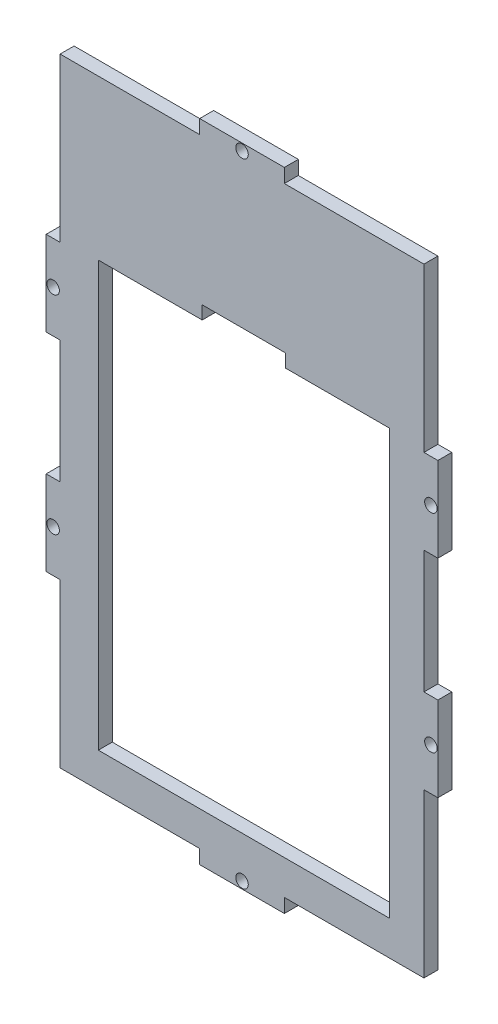
from build123d import *

# Parameters (mm, degrees)
BOSS_EXTRUDE1_DEPTH = 3.18
CUT_EXTRUDE1_DEPTH  = 82.82160381
SKETCH4_W           = 3.18
SKETCH4_H           = 19.3
BOSS_EXTRUDE2_DEPTH = 3.18
SKETCH5_R           = 1.425
CUT_EXTRUDE2_DEPTH  = 84.478168703
SKETCH6_W           = 3.18
SKETCH6_H           = 19.3
BOSS_EXTRUDE3_DEPTH = 3.18
SKETCH7_R           = 1.425
CUT_EXTRUDE3_DEPTH  = 84.478168703
SKETCH13_W          = 19.3
SKETCH13_H          = 3.18
BOSS_EXTRUDE6_DEPTH = 3.18
SKETCH14_R          = 1.425
CUT_EXTRUDE6_DEPTH  = 87.179315674
SKETCH15_W          = 19.3
SKETCH15_H          = 3.18
BOSS_EXTRUDE7_DEPTH = 3.18
SKETCH16_R          = 1.425
CUT_EXTRUDE7_DEPTH  = 87.179315674


with BuildPart() as part:
    # Sketch1 → Boss-Extrude1 (new body)
    with BuildSketch(Plane.XY):
        Polygon((-41.465, 70.465), (-13.821666667, 70.465), (13.821666667, 70.465), (41.465, 70.465), (41.465, -70.465), (-41.465, -70.465), align=None)
    extrude(amount=BOSS_EXTRUDE1_DEPTH)

    # Sketch3 → Cut-Extrude1 (cut, through all)
    with BuildSketch(Plane(origin=(0, 0, 0), x_dir=(-1, 0, 0), z_dir=(0, 0, -1))):
        Polygon((-9.92174207, 34.15325793), (-33.59674207, 34.15325793), (-33.59674207, -62.59674207), (32.75325793, -62.59674207), (32.75325793, 34.15325793), (9.07825793, 34.15325793), (9.07825793, 37.15325793), (-9.92174207, 37.15325793), align=None)
    extrude(amount=-CUT_EXTRUDE1_DEPTH, mode=Mode.SUBTRACT)

    # Sketch4 → Boss-Extrude2 (add)
    with BuildSketch(Plane.ZY.offset(41.465)):
        with Locations((1.59, 23.645)):
            Rectangle(SKETCH4_W, SKETCH4_H)
        with Locations((1.59, -23.645)):
            Rectangle(SKETCH4_W, SKETCH4_H)
    extrude(amount=BOSS_EXTRUDE2_DEPTH)

    # Sketch5 → Cut-Extrude2 (cut, through all)
    with BuildSketch(Plane.XY.offset(3.18)):
        with Locations((-43.055, 23.645)):
            Circle(SKETCH5_R)
        with Locations((-43.055, -23.645)):
            Circle(SKETCH5_R)
    extrude(amount=-CUT_EXTRUDE2_DEPTH, mode=Mode.SUBTRACT)

    # Sketch6 → Boss-Extrude3 (add)
    with BuildSketch(Plane(origin=(41.465, 0, 0), x_dir=(0, 0, -1), z_dir=(1, 0, 0))):
        with Locations((-1.59, -23.645)):
            Rectangle(SKETCH6_W, SKETCH6_H)
        with Locations((-1.59, 23.645)):
            Rectangle(SKETCH6_W, SKETCH6_H)
    extrude(amount=BOSS_EXTRUDE3_DEPTH)

    # Sketch7 → Cut-Extrude3 (cut, through all)
    with BuildSketch(Plane.XY.offset(3.18)):
        with Locations((43.055, 23.645)):
            Circle(SKETCH7_R)
        with Locations((43.055, -23.645)):
            Circle(SKETCH7_R)
    extrude(amount=-CUT_EXTRUDE3_DEPTH, mode=Mode.SUBTRACT)

    # Sketch13 → Boss-Extrude6 (add)
    with BuildSketch(Plane(origin=(0, 70.465, 0), x_dir=(1, 0, 0), z_dir=(0, 1, 0))):
        with Locations((0, -1.59)):
            Rectangle(SKETCH13_W, SKETCH13_H)
    extrude(amount=BOSS_EXTRUDE6_DEPTH)

    # Sketch14 → Cut-Extrude6 (cut, through all)
    with BuildSketch(Plane.XY.offset(3.18)):
        with Locations((0, 72.055)):
            Circle(SKETCH14_R)
    extrude(amount=-CUT_EXTRUDE6_DEPTH, mode=Mode.SUBTRACT)

    # Sketch15 → Boss-Extrude7 (add)
    with BuildSketch(Plane.XZ.offset(70.465)):
        with Locations((0, 1.59)):
            Rectangle(SKETCH15_W, SKETCH15_H)
    extrude(amount=BOSS_EXTRUDE7_DEPTH)

    # Sketch16 → Cut-Extrude7 (cut, through all)
    with BuildSketch(Plane.XY.offset(3.18)):
        with Locations((0, -72.055)):
            Circle(SKETCH16_R)
    extrude(amount=-CUT_EXTRUDE7_DEPTH, mode=Mode.SUBTRACT)


solid = part.part
